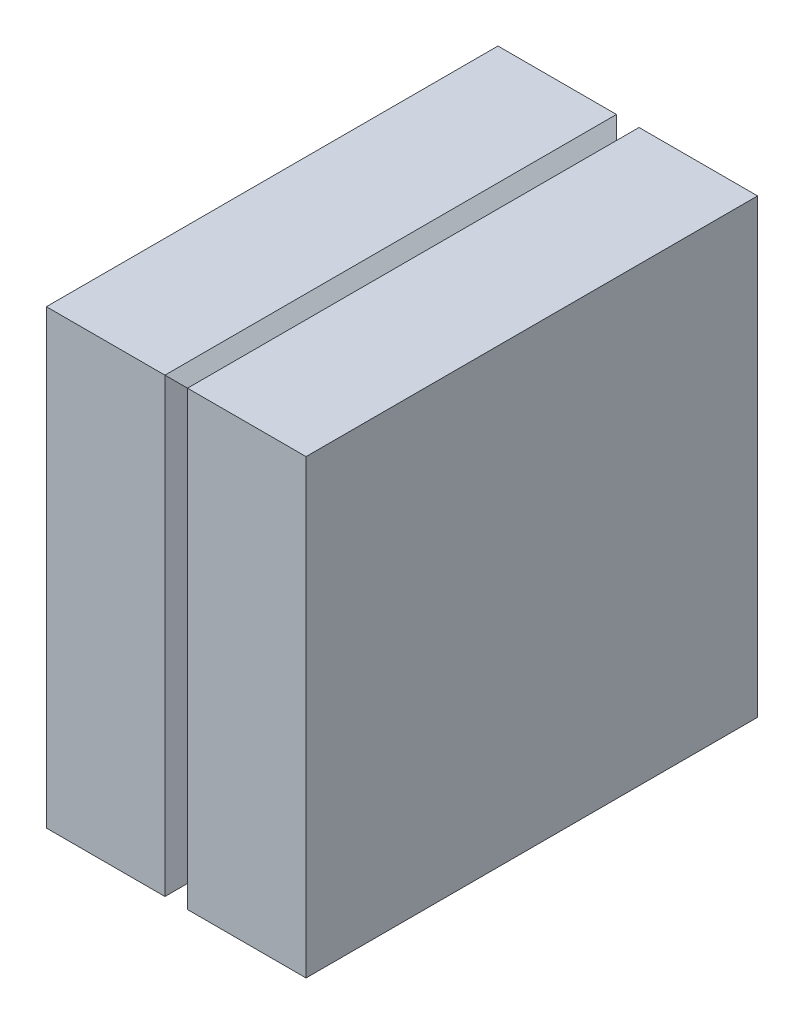
from build123d import *

# Parameters (mm, degrees)
CUT_EXTRUDE2_DEPTH       = 47.904157598
CIRPATTERN4_COUNT        = 30
BOSS_EXTRUDE2_DEPTH      = 23
BOSS_EXTRUDE2_DEPTH_BACK = 23
SKETCH8_W                = 80
SKETCH8_H                = 80
CUT_EXTRUDE6_REACH       = 94.353
SKETCH10_R               = 5
CHAMFER3_SIZE            = 4
CUT_EXTRUDE10_REACH      = 94.353
SKETCH14_R               = 0.25
LPATTERN1_START          = -41
LPATTERN1_OUTLINE_R      = 0.25
LPATTERN1_DEPTH          = 28
LPATTERN1_2_OUTLINE_R    = 0.25
LPATTERN1_2_DEPTH        = 12
SPLIT1_SURFACE_1_BACK    = 123.131
SPLIT1_SURFACE_1_DEPTH   = 246.262
SPLIT1_SURFACE_2_BACK    = 123.131
SPLIT1_SURFACE_2_DEPTH   = 246.262
SPLIT2_SURFACE_3_BACK    = 123.131
SPLIT2_SURFACE_3_DEPTH   = 246.262
SPLIT2_SURFACE_4_BACK    = 123.131
SPLIT2_SURFACE_4_DEPTH   = 246.262
CHAMFER4_SIZE            = 2
CHAMFER5_SIZE            = 2


with BuildPart() as part:
    # Sketch1 → Revolve1 (revolve)
    with BuildSketch(Plane.XY, mode=Mode.PRIVATE) as revolve1_sk:
        Polygon((-20, 30), (20, 30), (20, 27.05), (16.95, 27.05), (13.9, 24), (-16.95, 24), (-16.95, 27.05), (-20, 27.05), align=None)
    revolve(revolve1_sk.sketch.rotate(Axis((22, 0, 0), (-1, 0, 0)), 90), axis=Axis((22, 0, 0), (-1, 0, 0)))

    # Sketch6 → Cut-Extrude2 (cut, symmetric)
    with BuildSketch(Plane(origin=(0, 0, 0), x_dir=(0, 0, -1), z_dir=(1, 0, 0))):
        Polygon((-30, 1.75), (-29, 1.172649731), (-29, -1.172649731), (-30, -1.75), align=None)
    cut_extrude2 = extrude(amount=CUT_EXTRUDE2_DEPTH, both=True, mode=Mode.SUBTRACT)

    # CirPattern4: Cut-Extrude2 ×30 about axis
    cirpattern4_axis = Axis((0, 0, 0), (1, 0, 0))
    for i in range(1, CIRPATTERN4_COUNT):
        add(cut_extrude2.rotate(cirpattern4_axis, i * 360 / CIRPATTERN4_COUNT), mode=Mode.SUBTRACT)


with BuildPart() as body_2:
    # Sketch8 → Boss-Extrude2 (new, two sides: drawn at the far end of the back side and taken through both)
    with BuildSketch(Plane(origin=(0, 0, 0), x_dir=(0, 0, -1), z_dir=(1, 0, 0)).offset(-BOSS_EXTRUDE2_DEPTH_BACK)):
        Rectangle(SKETCH8_W, SKETCH8_H)
    extrude(amount=BOSS_EXTRUDE2_DEPTH + BOSS_EXTRUDE2_DEPTH_BACK)

    # Combine5: cut part
    add(part.part, mode=Mode.SUBTRACT)

    # Sketch10 → Cut-Extrude6 (cut, up to next)
    with BuildSketch(Plane(origin=(0, 0, -40), x_dir=(-1, 0, 0), z_dir=(0, 0, -1)), mode=Mode.PRIVATE) as cut_extrude6_sk1:
        with Locations(Location((0, 0, 0), (0, 0, 90))):
            Circle(SKETCH10_R)
    cut_extrude6_tool1 = extrude(cut_extrude6_sk1.sketch, amount=-CUT_EXTRUDE6_REACH, mode=Mode.PRIVATE) & body_2.part
    add(cut_extrude6_tool1.solids().sort_by_distance((0, 0, -40))[0], mode=Mode.SUBTRACT)

    # Chamfer3
    chamfer3_edges = [body_2.edges().sort_by_distance(p)[0] for p in [
        (0, -5, -40),
    ]]
    chamfer(chamfer3_edges, length=CHAMFER3_SIZE)

    # Sketch14 → Cut-Extrude10 (cut, up to next)
    with BuildSketch(Plane(origin=(0, 0, -40), x_dir=(-1, 0, 0), z_dir=(0, 0, -1)), mode=Mode.PRIVATE) as cut_extrude10_sk1:
        with Locations(Location((-12.5, 12.5, 0), (0, 0, 90))):
            Circle(SKETCH14_R)
    cut_extrude10_tool1 = extrude(cut_extrude10_sk1.sketch, amount=-CUT_EXTRUDE10_REACH, mode=Mode.PRIVATE) & body_2.part
    # Sketch14 → Cut-Extrude10 (cut, up to next)
    with BuildSketch(Plane(origin=(0, 0, -40), x_dir=(-1, 0, 0), z_dir=(0, 0, -1)), mode=Mode.PRIVATE) as cut_extrude10_sk2:
        with Locations(Location((12.5, 12.5, 0), (0, 0, 90))):
            Circle(SKETCH14_R)
    cut_extrude10_tool2 = extrude(cut_extrude10_sk2.sketch, amount=-CUT_EXTRUDE10_REACH, mode=Mode.PRIVATE) & body_2.part
    # Sketch14 → Cut-Extrude10 (cut, up to next)
    with BuildSketch(Plane(origin=(0, 0, -40), x_dir=(-1, 0, 0), z_dir=(0, 0, -1)), mode=Mode.PRIVATE) as cut_extrude10_sk3:
        with Locations(Location((12.5, -12.5, 0), (0, 0, 90))):
            Circle(SKETCH14_R)
    cut_extrude10_tool3 = extrude(cut_extrude10_sk3.sketch, amount=-CUT_EXTRUDE10_REACH, mode=Mode.PRIVATE) & body_2.part
    # Sketch14 → Cut-Extrude10 (cut, up to next)
    with BuildSketch(Plane(origin=(0, 0, -40), x_dir=(-1, 0, 0), z_dir=(0, 0, -1)), mode=Mode.PRIVATE) as cut_extrude10_sk4:
        with Locations(Location((-12.5, -12.5, 0), (0, 0, 90))):
            Circle(SKETCH14_R)
    cut_extrude10_tool4 = extrude(cut_extrude10_sk4.sketch, amount=-CUT_EXTRUDE10_REACH, mode=Mode.PRIVATE) & body_2.part
    add(cut_extrude10_tool1.solids().sort_by_distance((12.5, 12.5, -40))[0], mode=Mode.SUBTRACT)
    add(cut_extrude10_tool2.solids().sort_by_distance((-12.5, 12.5, -40))[0], mode=Mode.SUBTRACT)
    add(cut_extrude10_tool3.solids().sort_by_distance((-12.5, -12.5, -40))[0], mode=Mode.SUBTRACT)
    add(cut_extrude10_tool4.solids().sort_by_distance((12.5, -12.5, -40))[0], mode=Mode.SUBTRACT)

    # LPattern1: read off the stored shape, not the designer's step
    # LPattern1 outline → LPattern1 (cut)
    with BuildSketch(Plane.XY.offset(LPATTERN1_START)):
        with Locations((12.5, 25)):
            Circle(LPATTERN1_OUTLINE_R)
        with Locations((12.5, -25)):
            Circle(LPATTERN1_OUTLINE_R)
        with Locations((-12.5, -25)):
            Circle(LPATTERN1_OUTLINE_R)
        with Locations((-12.5, 25)):
            Circle(LPATTERN1_OUTLINE_R)
    extrude(amount=LPATTERN1_DEPTH, mode=Mode.SUBTRACT)

    # LPattern1 2 outline → LPattern1 2 (cut)
    with BuildSketch(Plane.XY.offset(LPATTERN1_START)):
        with Locations((12.5, 0)):
            Circle(LPATTERN1_2_OUTLINE_R)
        with Locations((-12.5, 0)):
            Circle(LPATTERN1_2_OUTLINE_R)
    extrude(amount=LPATTERN1_2_DEPTH, mode=Mode.SUBTRACT)


with BuildPart() as body_2_2:
    # Split1: the piece behind the surface
    add(body_2.part)
    # Split1 surface: a surface, the sketch's curves swept straight by 246.262 mm
    with BuildLine(Plane(origin=(0, 40, 0), x_dir=(1, 0, 0), z_dir=(0, 1, 0)).offset(-SPLIT1_SURFACE_1_BACK), mode=Mode.PRIVATE) as split1_surface_1_path:
        Line((0, 40), (0, -40))
    split1_surface_1 = Shell.extrude(split1_surface_1_path.wire(), (0 * SPLIT1_SURFACE_1_DEPTH, 1 * SPLIT1_SURFACE_1_DEPTH, 0 * SPLIT1_SURFACE_1_DEPTH))
    split(bisect_by=split1_surface_1, keep=Keep.BOTTOM)


with BuildPart() as body_2_1:
    add(body_2.part)

    # Split1: split by a surface, the side it looks to stays
    # Split1 surface: a surface, the sketch's curves swept straight by 246.262 mm
    with BuildLine(Plane(origin=(0, 40, 0), x_dir=(1, 0, 0), z_dir=(0, 1, 0)).offset(-SPLIT1_SURFACE_2_BACK), mode=Mode.PRIVATE) as split1_surface_2_path:
        Line((0, 40), (0, -40))
    split1_surface_2 = Shell.extrude(split1_surface_2_path.wire(), (0 * SPLIT1_SURFACE_2_DEPTH, 1 * SPLIT1_SURFACE_2_DEPTH, 0 * SPLIT1_SURFACE_2_DEPTH))
    split(bisect_by=split1_surface_2, keep=Keep.TOP)

    # Combine6: union body 2 2
    add(body_2_2.part)


with BuildPart() as body_2_3:
    # Split2: the piece behind the surface
    add(body_2_1.part)
    # Split2 surface: a surface, the sketch's curves swept straight by 246.262 mm
    with BuildLine(Plane(origin=(0, 40, 0), x_dir=(1, 0, 0), z_dir=(0, 1, 0)).offset(-SPLIT2_SURFACE_3_BACK), mode=Mode.PRIVATE) as split2_surface_3_path:
        Line((0, 40), (0, -40))
    split2_surface_3 = Shell.extrude(split2_surface_3_path.wire(), (0 * SPLIT2_SURFACE_3_DEPTH, 1 * SPLIT2_SURFACE_3_DEPTH, 0 * SPLIT2_SURFACE_3_DEPTH))
    split(bisect_by=split2_surface_3, keep=Keep.BOTTOM)

    # Chamfer4
    # the kernel refuses this chamfer: 2 mm, written as the material it takes off along each edge
    with BuildSketch(Plane(origin=(0, -40, -45.143365976), x_dir=(-1, 0, 0), z_dir=(0, 0, 1)), Plane(origin=(0, 40, 45.143365976), x_dir=(-1, 0, 0), z_dir=(0, 0, -1))) as chamfer4_piece_1:
        Polygon((CHAMFER4_SIZE, 0), (0, -CHAMFER4_SIZE), (0, 0), align=None)
    extrude(amount=90.286731952, mode=Mode.SUBTRACT)
    with BuildSketch(Plane(origin=(0, -45.143365976, 40), x_dir=(0, 0, -1), z_dir=(0, 1, 0))) as chamfer4_piece_2:
        Polygon((CHAMFER4_SIZE, 0), (0, CHAMFER4_SIZE), (0, 0), align=None)
    extrude(amount=90.286731952, mode=Mode.SUBTRACT)
    with BuildSketch(Plane(origin=(0, -45.143365976, -40), x_dir=(-1, 0, 0), z_dir=(0, 1, 0)), Plane(origin=(0, 3.856634024, -40), x_dir=(-1, 0, 0), z_dir=(0, 1, 0))) as chamfer4_piece_3:
        Polygon((CHAMFER4_SIZE, 0), (0, CHAMFER4_SIZE), (0, 0), align=None)
    extrude(amount=41.286731952, mode=Mode.SUBTRACT)


with BuildPart() as body_2_4:
    add(body_2_1.part)

    # Split2: split by a surface, the side it looks to stays
    # Split2 surface: a surface, the sketch's curves swept straight by 246.262 mm
    with BuildLine(Plane(origin=(0, 40, 0), x_dir=(1, 0, 0), z_dir=(0, 1, 0)).offset(-SPLIT2_SURFACE_4_BACK), mode=Mode.PRIVATE) as split2_surface_4_path:
        Line((0, 40), (0, -40))
    split2_surface_4 = Shell.extrude(split2_surface_4_path.wire(), (0 * SPLIT2_SURFACE_4_DEPTH, 1 * SPLIT2_SURFACE_4_DEPTH, 0 * SPLIT2_SURFACE_4_DEPTH))
    split(bisect_by=split2_surface_4, keep=Keep.TOP)

    # Chamfer5
    chamfer5_edges = [body_2_4.edges().sort_by_distance(p)[0] for p in [
        (0, 24.5, -40),
        (0, -24.5, -40),
        (0, 40, 0),
        (0, 0, 40),
        (0, -40, 0),
    ]]
    chamfer(chamfer5_edges, length=CHAMFER5_SIZE)


solid = Compound([body_2_3.part, body_2_4.part])
